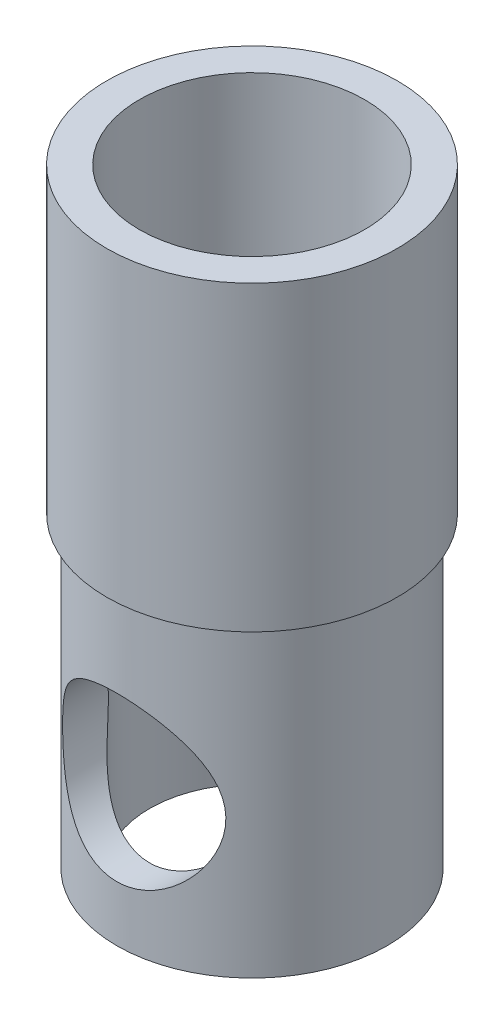
from build123d import *

# Parameters (mm, degrees)
BOSS_EXTRUDE1_DEPTH      = 1
BOSS_EXTRUDE1_DEPTH_BACK = 17.8
SKETCH1_R                = 8.28
SKETCH1_R_2              = 6.28
SKETCH2_R                = 8.9
SKETCH2_R_2              = 6.9
BOSS_EXTRUDE2_DEPTH      = 18.5
SKETCH3_R                = 5
CUT_EXTRUDE1_DEPTH       = 24.209265391


with BuildPart() as part:
    # Sketch1 → Boss-Extrude1 (new, two sides: drawn at the far end of the back side and taken through both)
    with BuildSketch(Plane(origin=(0, 0, 0), x_dir=(1, 0, 0), z_dir=(0, 1, 0)).offset(-BOSS_EXTRUDE1_DEPTH_BACK)):
        Circle(SKETCH1_R)
        Circle(SKETCH1_R_2, mode=Mode.SUBTRACT)
    extrude(amount=BOSS_EXTRUDE1_DEPTH + BOSS_EXTRUDE1_DEPTH_BACK)

    # Sketch2 → Boss-Extrude2 (add)
    with BuildSketch(Plane(origin=(0, 1, 0), x_dir=(1, 0, 0), z_dir=(0, 1, 0))):
        Circle(SKETCH2_R)
        Circle(SKETCH2_R_2, mode=Mode.SUBTRACT)
    extrude(amount=BOSS_EXTRUDE2_DEPTH)

    # Sketch3 → Cut-Extrude1 (cut, through all)
    with BuildSketch(Plane.XY):
        with Locations((0, -9.4)):
            Circle(SKETCH3_R)
    extrude(amount=CUT_EXTRUDE1_DEPTH, mode=Mode.SUBTRACT)


solid = part.part
